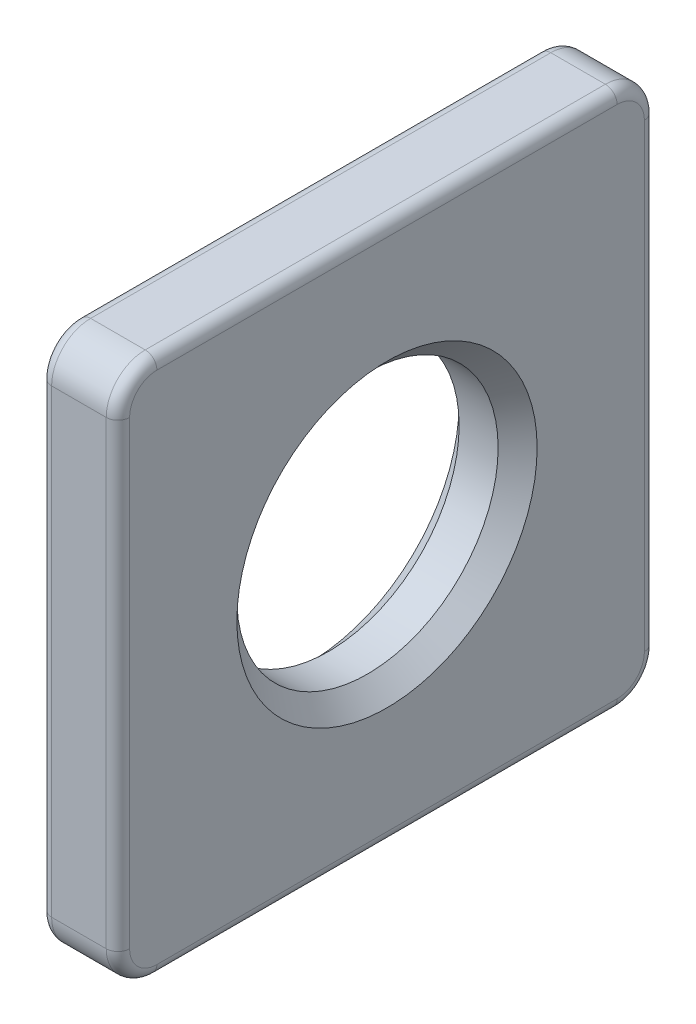
from build123d import *

# Parameters (mm, degrees)
SKETCH1_W           = 13.8
SKETCH1_H           = 13.8
BOSS_EXTRUDE1_DEPTH = 2
SKETCH2_R           = 3.35
CUT_EXTRUDE1_DEPTH  = 10.960923652
CHAMFER1_SIZE       = 0.5
FILLET1_R           = 1
FILLET2_R           = 0.3


with BuildPart() as part:
    # Sketch1 → Boss-Extrude1 (new body)
    with BuildSketch(Plane(origin=(0, 0, 0), x_dir=(0, 0, -1), z_dir=(1, 0, 0))):
        Rectangle(SKETCH1_W, SKETCH1_H)
    extrude(amount=BOSS_EXTRUDE1_DEPTH)

    # Sketch2 → Cut-Extrude1 (cut, through all)
    with BuildSketch(Plane(origin=(0, 0, 0), x_dir=(0, 0, -1), z_dir=(1, 0, 0))):
        Circle(SKETCH2_R)
    extrude(amount=CUT_EXTRUDE1_DEPTH, mode=Mode.SUBTRACT)

    # Chamfer1
    chamfer1_edges = [part.edges().sort_by_distance(p)[0] for p in [
        (0, 0, 3.35),
        (2, 0, 3.35),
    ]]
    chamfer(chamfer1_edges, length=CHAMFER1_SIZE)

    # Fillet1
    fillet1_edges = [part.edges().sort_by_distance(p)[0] for p in [
        (1, 6.9, -6.9),
        (1, -6.9, -6.9),
        (1, -6.9, 6.9),
        (1, 6.9, 6.9),
    ]]
    fillet(fillet1_edges, radius=FILLET1_R)

    # Fillet2
    fillet2_edges = [part.edges().sort_by_distance(p)[0] for p in [
        (0, 6.607106781, 6.607106781),
        (0, 6.9, 0),
        (0, 6.607106781, -6.607106781),
        (0, 0, -6.9),
        (0, -6.607106781, -6.607106781),
        (0, -6.9, 0),
        (0, -6.607106781, 6.607106781),
        (2, -6.607106781, 6.607106781),
        (2, 0, 6.9),
        (2, 6.607106781, 6.607106781),
        (2, 6.9, 0),
        (2, 6.607106781, -6.607106781),
        (2, 0, -6.9),
        (2, -6.607106781, -6.607106781),
        (0, 0, 6.9),
        (2, -6.9, 0),
    ]]
    fillet(fillet2_edges, radius=FILLET2_R)


solid = part.part
